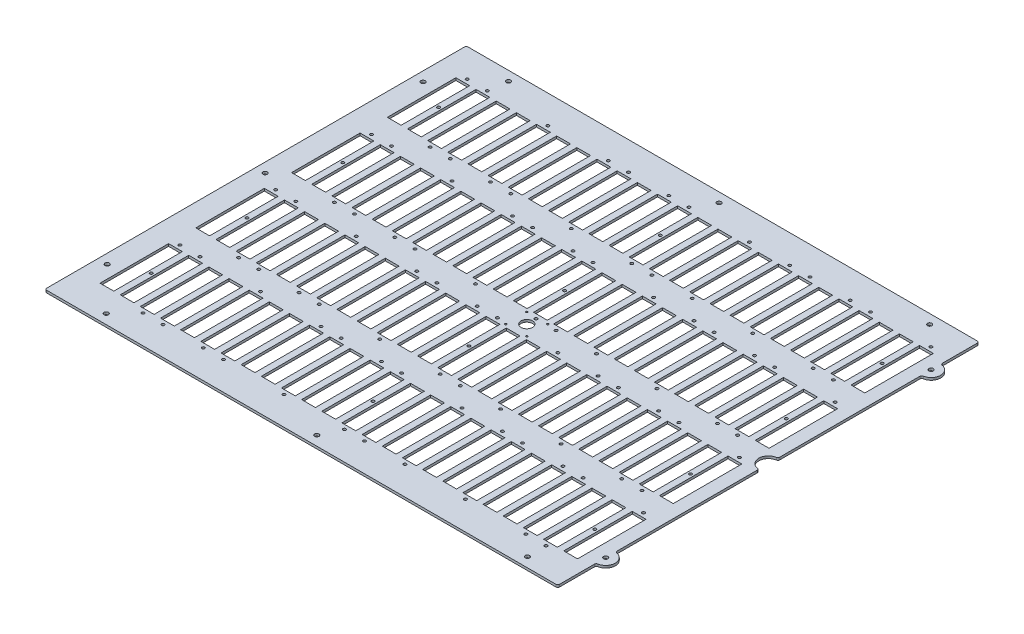
from build123d import *

# Parameters (mm, degrees)
BOSS_EXTRUDE1_DEPTH          = 3.175
SKETCH17_W                   = 18.288
SKETCH17_H                   = 90.932
CUT_EXTRUDE5_DEPTH           = 451.265762746
F_25_0_1495_DIAMETER_HOLE1_D = 3.7973
FILLET1_R                    = 2.54
F_6_CLEARANCE_HOLE1_D        = 3.7973
F_2_CLEARANCE_HOLE1_D        = 2.4384
SKETCH20_R                   = 7.62
CUT_EXTRUDE6_DEPTH           = 451.265762746
F_1_0_228_DIAMETER_HOLE1_D   = 5.7912


with BuildPart() as part:
    # Sketch1 → Boss-Extrude1 (new body)
    with BuildSketch(Plane(origin=(0, 0, 0), x_dir=(1, 0, 0), z_dir=(0, 1, 0))):
        with BuildLine():
            Line((340.2584, 228.6), (340.2584, 279.5524))
            Line((340.2584, 279.5524), (-340.2584, 279.5524))
            Line((-340.2584, 279.5524), (-340.2584, -279.5524))
            Line((-340.2584, -279.5524), (340.2584, -279.5524))
            Line((340.2584, -279.5524), (340.2584, -228.6))
            ThreePointArc((340.2584, -228.6), (352.9584, -215.9), (340.2584, -203.2))
            Line((340.2584, -203.2), (340.2584, -12.7))
            ThreePointArc((340.2584, -12.7), (327.5584, 0), (340.2584, 12.7))
            Line((340.2584, 12.7), (340.2584, 203.2))
            ThreePointArc((340.2584, 203.2), (352.9584, 215.9), (340.2584, 228.6))
        make_face()
    extrude(amount=BOSS_EXTRUDE1_DEPTH)

    # Sketch17 → Cut-Extrude5 (cut, through all)
    with BuildSketch(Plane(origin=(0, 3.175, 0), x_dir=(1, 0, 0), z_dir=(0, 1, 0))):
        with Locations((-274.696582609, 190.6524)):
            Rectangle(SKETCH17_W, SKETCH17_H)
        with Locations((-301.4472, 190.6524)):
            Rectangle(SKETCH17_W, SKETCH17_H)
        with Locations((-247.945965217, 190.6524)):
            Rectangle(SKETCH17_W, SKETCH17_H)
        with Locations((-221.195347826, 190.6524)):
            Rectangle(SKETCH17_W, SKETCH17_H)
        with Locations((-194.444730435, 190.6524)):
            Rectangle(SKETCH17_W, SKETCH17_H)
        with Locations((-167.694113043, 190.6524)):
            Rectangle(SKETCH17_W, SKETCH17_H)
        with Locations((-140.943495652, 190.6524)):
            Rectangle(SKETCH17_W, SKETCH17_H)
        with Locations((-114.192878261, 190.6524)):
            Rectangle(SKETCH17_W, SKETCH17_H)
        with Locations((-87.44226087, 190.6524)):
            Rectangle(SKETCH17_W, SKETCH17_H)
        with Locations((-60.691643478, 190.6524)):
            Rectangle(SKETCH17_W, SKETCH17_H)
        with Locations((-33.941026087, 190.6524)):
            Rectangle(SKETCH17_W, SKETCH17_H)
        with Locations((-7.190408696, 190.6524)):
            Rectangle(SKETCH17_W, SKETCH17_H)
        with Locations((19.560208696, 190.6524)):
            Rectangle(SKETCH17_W, SKETCH17_H)
        with Locations((46.310826087, 190.6524)):
            Rectangle(SKETCH17_W, SKETCH17_H)
        with Locations((73.061443478, 190.6524)):
            Rectangle(SKETCH17_W, SKETCH17_H)
        with Locations((99.81206087, 190.6524)):
            Rectangle(SKETCH17_W, SKETCH17_H)
        with Locations((126.562678261, 190.6524)):
            Rectangle(SKETCH17_W, SKETCH17_H)
        with Locations((153.313295652, 190.6524)):
            Rectangle(SKETCH17_W, SKETCH17_H)
        with Locations((180.063913043, 190.6524)):
            Rectangle(SKETCH17_W, SKETCH17_H)
        with Locations((206.814530435, 190.6524)):
            Rectangle(SKETCH17_W, SKETCH17_H)
        with Locations((233.565147826, 190.6524)):
            Rectangle(SKETCH17_W, SKETCH17_H)
        with Locations((260.315765217, 190.6524)):
            Rectangle(SKETCH17_W, SKETCH17_H)
        with Locations((287.066382609, 190.6524)):
            Rectangle(SKETCH17_W, SKETCH17_H)
        with Locations((313.817, 190.6524)):
            Rectangle(SKETCH17_W, SKETCH17_H)
        with Locations((-274.696582609, 63.5762)):
            Rectangle(SKETCH17_W, SKETCH17_H)
        with Locations((-247.945965217, 63.5762)):
            Rectangle(SKETCH17_W, SKETCH17_H)
        with Locations((-221.195347826, 63.5762)):
            Rectangle(SKETCH17_W, SKETCH17_H)
        with Locations((-194.444730435, 63.5762)):
            Rectangle(SKETCH17_W, SKETCH17_H)
        with Locations((-167.694113043, 63.5762)):
            Rectangle(SKETCH17_W, SKETCH17_H)
        with Locations((-140.943495652, 63.5762)):
            Rectangle(SKETCH17_W, SKETCH17_H)
        with Locations((-114.192878261, 63.5762)):
            Rectangle(SKETCH17_W, SKETCH17_H)
        with Locations((-87.44226087, 63.5762)):
            Rectangle(SKETCH17_W, SKETCH17_H)
        with Locations((-60.691643478, 63.5762)):
            Rectangle(SKETCH17_W, SKETCH17_H)
        with Locations((-33.941026087, 63.5762)):
            Rectangle(SKETCH17_W, SKETCH17_H)
        with Locations((-7.190408696, 63.5762)):
            Rectangle(SKETCH17_W, SKETCH17_H)
        with Locations((19.560208696, 63.5762)):
            Rectangle(SKETCH17_W, SKETCH17_H)
        with Locations((46.310826087, 63.5762)):
            Rectangle(SKETCH17_W, SKETCH17_H)
        with Locations((73.061443478, 63.5762)):
            Rectangle(SKETCH17_W, SKETCH17_H)
        with Locations((99.81206087, 63.5762)):
            Rectangle(SKETCH17_W, SKETCH17_H)
        with Locations((126.562678261, 63.5762)):
            Rectangle(SKETCH17_W, SKETCH17_H)
        with Locations((153.313295652, 63.5762)):
            Rectangle(SKETCH17_W, SKETCH17_H)
        with Locations((180.063913043, 63.5762)):
            Rectangle(SKETCH17_W, SKETCH17_H)
        with Locations((206.814530435, 63.5762)):
            Rectangle(SKETCH17_W, SKETCH17_H)
        with Locations((233.565147826, 63.5762)):
            Rectangle(SKETCH17_W, SKETCH17_H)
        with Locations((260.315765217, 63.5762)):
            Rectangle(SKETCH17_W, SKETCH17_H)
        with Locations((287.066382609, 63.5762)):
            Rectangle(SKETCH17_W, SKETCH17_H)
        with Locations((313.817, 63.5762)):
            Rectangle(SKETCH17_W, SKETCH17_H)
        with Locations((-274.696582609, -63.5)):
            Rectangle(SKETCH17_W, SKETCH17_H)
        with Locations((-247.945965217, -63.5)):
            Rectangle(SKETCH17_W, SKETCH17_H)
        with Locations((-221.195347826, -63.5)):
            Rectangle(SKETCH17_W, SKETCH17_H)
        with Locations((-194.444730435, -63.5)):
            Rectangle(SKETCH17_W, SKETCH17_H)
        with Locations((-167.694113043, -63.5)):
            Rectangle(SKETCH17_W, SKETCH17_H)
        with Locations((-140.943495652, -63.5)):
            Rectangle(SKETCH17_W, SKETCH17_H)
        with Locations((-114.192878261, -63.5)):
            Rectangle(SKETCH17_W, SKETCH17_H)
        with Locations((-87.44226087, -63.5)):
            Rectangle(SKETCH17_W, SKETCH17_H)
        with Locations((-60.691643478, -63.5)):
            Rectangle(SKETCH17_W, SKETCH17_H)
        with Locations((-33.941026087, -63.5)):
            Rectangle(SKETCH17_W, SKETCH17_H)
        with Locations((-7.190408696, -63.5)):
            Rectangle(SKETCH17_W, SKETCH17_H)
        with Locations((19.560208696, -63.5)):
            Rectangle(SKETCH17_W, SKETCH17_H)
        with Locations((46.310826087, -63.5)):
            Rectangle(SKETCH17_W, SKETCH17_H)
        with Locations((73.061443478, -63.5)):
            Rectangle(SKETCH17_W, SKETCH17_H)
        with Locations((99.81206087, -63.5)):
            Rectangle(SKETCH17_W, SKETCH17_H)
        with Locations((126.562678261, -63.5)):
            Rectangle(SKETCH17_W, SKETCH17_H)
        with Locations((153.313295652, -63.5)):
            Rectangle(SKETCH17_W, SKETCH17_H)
        with Locations((180.063913043, -63.5)):
            Rectangle(SKETCH17_W, SKETCH17_H)
        with Locations((206.814530435, -63.5)):
            Rectangle(SKETCH17_W, SKETCH17_H)
        with Locations((233.565147826, -63.5)):
            Rectangle(SKETCH17_W, SKETCH17_H)
        with Locations((260.315765217, -63.5)):
            Rectangle(SKETCH17_W, SKETCH17_H)
        with Locations((287.066382609, -63.5)):
            Rectangle(SKETCH17_W, SKETCH17_H)
        with Locations((313.817, -63.5)):
            Rectangle(SKETCH17_W, SKETCH17_H)
        with Locations((-274.696582609, -190.5762)):
            Rectangle(SKETCH17_W, SKETCH17_H)
        with Locations((-247.945965217, -190.5762)):
            Rectangle(SKETCH17_W, SKETCH17_H)
        with Locations((-221.195347826, -190.5762)):
            Rectangle(SKETCH17_W, SKETCH17_H)
        with Locations((-194.444730435, -190.5762)):
            Rectangle(SKETCH17_W, SKETCH17_H)
        with Locations((-167.694113043, -190.5762)):
            Rectangle(SKETCH17_W, SKETCH17_H)
        with Locations((-140.943495652, -190.5762)):
            Rectangle(SKETCH17_W, SKETCH17_H)
        with Locations((-114.192878261, -190.5762)):
            Rectangle(SKETCH17_W, SKETCH17_H)
        with Locations((-87.44226087, -190.5762)):
            Rectangle(SKETCH17_W, SKETCH17_H)
        with Locations((-60.691643478, -190.5762)):
            Rectangle(SKETCH17_W, SKETCH17_H)
        with Locations((-33.941026087, -190.5762)):
            Rectangle(SKETCH17_W, SKETCH17_H)
        with Locations((-7.190408696, -190.5762)):
            Rectangle(SKETCH17_W, SKETCH17_H)
        with Locations((19.560208696, -190.5762)):
            Rectangle(SKETCH17_W, SKETCH17_H)
        with Locations((46.310826087, -190.5762)):
            Rectangle(SKETCH17_W, SKETCH17_H)
        with Locations((73.061443478, -190.5762)):
            Rectangle(SKETCH17_W, SKETCH17_H)
        with Locations((99.81206087, -190.5762)):
            Rectangle(SKETCH17_W, SKETCH17_H)
        with Locations((126.562678261, -190.5762)):
            Rectangle(SKETCH17_W, SKETCH17_H)
        with Locations((153.313295652, -190.5762)):
            Rectangle(SKETCH17_W, SKETCH17_H)
        with Locations((180.063913043, -190.5762)):
            Rectangle(SKETCH17_W, SKETCH17_H)
        with Locations((206.814530435, -190.5762)):
            Rectangle(SKETCH17_W, SKETCH17_H)
        with Locations((233.565147826, -190.5762)):
            Rectangle(SKETCH17_W, SKETCH17_H)
        with Locations((260.315765217, -190.5762)):
            Rectangle(SKETCH17_W, SKETCH17_H)
        with Locations((287.066382609, -190.5762)):
            Rectangle(SKETCH17_W, SKETCH17_H)
        with Locations((313.817, -190.5762)):
            Rectangle(SKETCH17_W, SKETCH17_H)
        with Locations((-301.4472, 63.5762)):
            Rectangle(SKETCH17_W, SKETCH17_H)
        with Locations((-301.4472, -63.5)):
            Rectangle(SKETCH17_W, SKETCH17_H)
        with Locations((-301.4472, -190.5762)):
            Rectangle(SKETCH17_W, SKETCH17_H)
    extrude(amount=-CUT_EXTRUDE5_DEPTH, mode=Mode.SUBTRACT)

    # #25 (0.1495) Diameter Hole1 (through all)
    with Locations(Plane(origin=(0, 3.175, 0), x_dir=(1, 0, 0), z_dir=(0, 1, 0))):
        with Locations((313.816998222, -139.2682), (-301.4472, 241.9604), (-274.696582686, 241.9604), (-247.945965372, 139.3444), (-221.195348058, 139.3444), (-194.444730744, 241.9604), (-167.69411343, 139.3444), (-140.943496116, 139.3444), (-114.192878802, 241.9604), (-87.442261488, 241.9604), (-60.691644174, 139.3444), (-33.94102686, 241.9604), (-7.190409546, 241.9604), (19.560207768, 139.3444), (46.310825082, 139.3444), (73.061442396, 241.9604), (99.81205971, 139.3444), (126.562677024, 241.9604), (153.313294338, 241.9604), (180.063911652, 139.3444), (206.814528966, 241.9604), (233.56514628, 241.9604), (260.315763594, 139.3444), (287.066380908, 139.3444), (313.816998222, 241.9604), (-301.4472, 114.8842), (-274.696582686, 114.8842), (-247.945965372, 12.2682), (-221.195348058, 12.2682), (-194.444730744, 114.8842), (-167.69411343, 12.2682), (-140.943496116, 12.2682), (-114.192878802, 114.8842), (-87.442261488, 114.8842), (-60.691644174, 12.2682), (-33.94102686, 114.8842), (-7.190409546, 114.8842), (19.560207768, 12.2682), (46.310825082, 12.2682), (73.061442396, 114.8842), (99.81205971, 12.2682), (126.562677024, 114.8842), (153.313294338, 114.8842), (180.063911652, 12.2682), (206.814528966, 114.8842), (233.56514628, 114.8842), (260.315763594, 12.2682), (287.066380908, 12.2682), (313.816998222, 114.8842), (-301.4472, -12.192), (-274.696582686, -12.192), (-247.945965372, -114.808), (-221.195348058, -114.808), (-194.444730744, -12.192), (-167.69411343, -114.808), (-140.943496116, -114.808), (-114.192878802, -12.192), (-87.442261488, -12.192), (-60.691644174, -114.808), (-33.94102686, -12.192), (-7.190409546, -12.192), (19.560207768, -114.808), (46.310825082, -114.808), (73.061442396, -12.192), (99.81205971, -114.808), (126.562677024, -12.192), (153.313294338, -12.192), (180.063911652, -114.808), (206.814528966, -12.192), (233.56514628, -12.192), (260.315763594, -114.808), (287.066380908, -114.808), (313.816998222, -12.192), (-301.4472, -139.2682), (-274.696582686, -139.2682), (-247.945965372, -241.8842), (-221.195348058, -241.8842), (-194.444730744, -139.2682), (-167.69411343, -241.8842), (-140.943496116, -241.8842), (-114.192878802, -139.2682), (-87.442261488, -139.2682), (-60.691644174, -241.8842), (-33.94102686, -139.2682), (-7.190409546, -139.2682), (19.560207768, -241.8842), (46.310825082, -241.8842), (73.061442396, -139.2682), (99.81205971, -241.8842), (126.562677024, -139.2682), (153.313294338, -139.2682), (180.063911652, -241.8842), (206.814528966, -139.2682), (233.56514628, -139.2682), (260.315763594, -241.8842), (287.066380908, -241.8842)):
            Hole(F_25_0_1495_DIAMETER_HOLE1_D / 2)

    # Fillet1
    fillet1_edges = [part.edges().sort_by_distance(p)[0] for p in [
        (-340.2584, 1.5875, -279.5524),
        (-340.2584, 1.5875, 279.5524),
        (340.2584, 1.5875, 279.5524),
        (340.2584, 1.5875, 228.6),
        (340.2584, 1.5875, 203.2),
        (340.2584, 1.5875, 12.7),
        (340.2584, 1.5875, -12.7),
        (340.2584, 1.5875, -203.2),
        (340.2584, 1.5875, -279.5524),
        (340.2584, 1.5875, -228.6),
    ]]
    fillet(fillet1_edges, radius=FILLET1_R)

    # #6 Clearance Hole1 (through all)
    with Locations(Plane(origin=(0, 3.175, 0), x_dir=(1, 0, 0), z_dir=(0, 1, 0))):
        with Locations((300.441691304, -190.5762), (-288.071891304, 190.6524), (6.1849, 190.6524), (300.441691304, 190.6524), (-288.071891304, 63.5762), (6.1849, 63.5762), (300.441691304, 63.5762), (-288.071891304, -63.5), (6.1849, -63.5), (300.441691304, -63.5), (-288.071891304, -190.5762), (6.1849, -190.5762)):
            Hole(F_6_CLEARANCE_HOLE1_D / 2)

    # #2 Clearance Hole1 (through all)
    with Locations(Plane(origin=(0, 3.175, 0), x_dir=(1, 0, 0), z_dir=(0, 1, 0))):
        with Locations((33.5661, 14.0081), (5.6261, 14.0081), (5.6261, -13.9319), (33.5661, -13.9319)):
            Hole(F_2_CLEARANCE_HOLE1_D / 2)

    # Sketch20 → Cut-Extrude6 (cut, through all)
    with BuildSketch(Plane(origin=(0, 3.175, 0), x_dir=(1, 0, 0), z_dir=(0, 1, 0))):
        with Locations((19.5961, 0.0381)):
            Circle(SKETCH20_R)
    extrude(amount=-CUT_EXTRUDE6_DEPTH, mode=Mode.SUBTRACT)

    # #1 (0.228) Diameter Hole1 (through all)
    with Locations(Plane(origin=(0, 3.175, 0), x_dir=(1, 0, 0), z_dir=(0, 1, 0))):
        with Locations((287.274, -266.8524), (340.2584, -215.9), (340.2584, 0), (340.2584, 215.9), (287.274, 266.8524), (7.874, 266.8524), (-271.526, 266.8524), (-327.5584, 209.55), (-327.5584, 0), (-327.5584, -209.55), (-271.526, -266.8524), (7.874, -266.8524)):
            Hole(F_1_0_228_DIAMETER_HOLE1_D / 2)


solid = part.part
